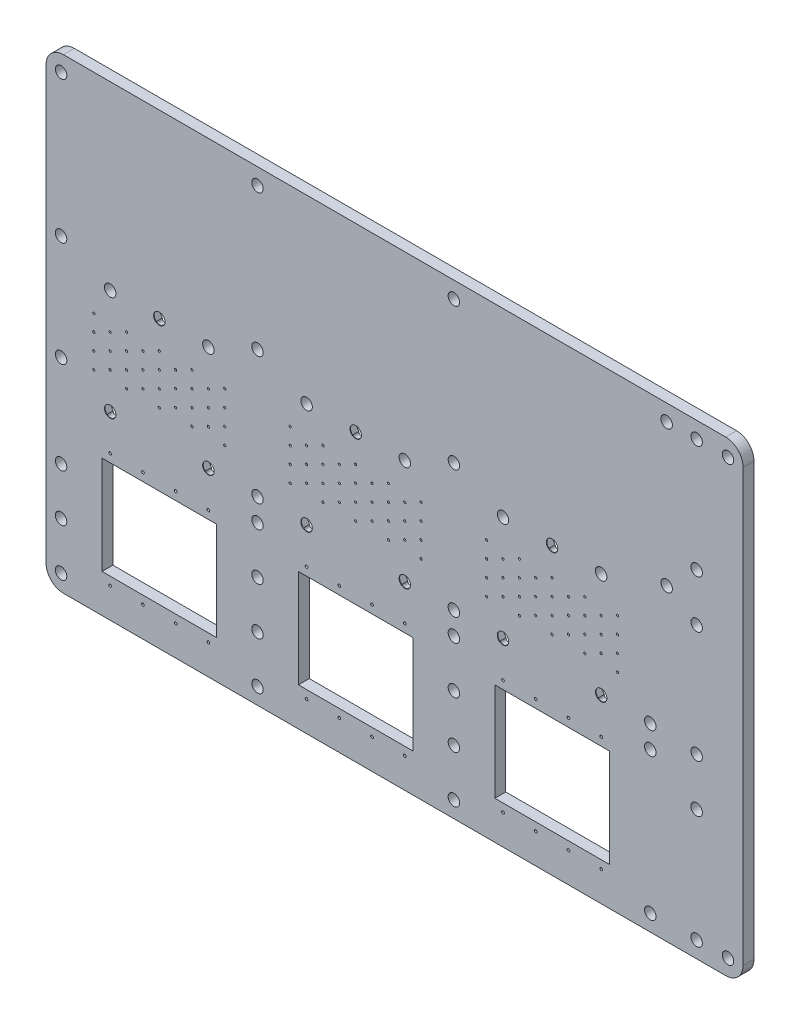
from build123d import *

# Parameters (mm, degrees)
BASE_PLATE_DEPTH          = 2
SENSOR_BLOCK_2_R          = 1.05
SENSOR_BLOCK_DEPTH        = 10
SCREW_HOLES_R             = 0.25
SCREW_HOLES_R_2           = 1.05
SCREW_HOLES_W             = 21
SCREW_HOLES_H             = 18
OBSERVATION_WINDOW_DEPTH  = 10
ROUTING_BLOCK_R           = 0.2
ROUTING_BLOCK_PORTS_DEPTH = 10
SKETCH5_R                 = 1.375
BOTTOM_O_RINGS_DEPTH      = 0.85
SKETCH6_R                 = 1
BOLT_RECESS_DEPTH         = 1.9


with BuildPart() as part:
    # Sketch1 → Base Plate (new body)
    with BuildSketch(Plane.XY):
        with BuildLine():
            Line((-64.286844883, 40.243593117), (-64.286844883, -38.896406883))
            ThreePointArc((-64.286844883, -38.896406883), (-63.355444448, -41.145006447), (-61.106844883, -42.076406883))
            Line((-61.106844883, -42.076406883), (60.283155117, -42.076406883))
            ThreePointArc((60.283155117, -42.076406883), (62.531754681, -41.145006447), (63.463155117, -38.896406883))
            Line((63.463155117, -38.896406883), (63.463155117, 40.243593117))
            ThreePointArc((63.463155117, 40.243593117), (62.531754681, 42.492192682), (60.283155117, 43.423593117))
            Line((60.283155117, 43.423593117), (-61.106844883, 43.423593117))
            ThreePointArc((-61.106844883, 43.423593117), (-63.355444448, 42.492192682), (-64.286844883, 40.243593117))
        make_face()
    extrude(amount=BASE_PLATE_DEPTH)

    # Sensor Block 2 → Sensor block (cut)
    with BuildSketch(Plane.XY.offset(2)):
        with Locations((54.962733273, 40.421899296)):
            Circle(SENSOR_BLOCK_2_R)
        with Locations((54.962733273, 19.684374225)):
            Circle(SENSOR_BLOCK_2_R)
        with Locations((54.962733273, 10.919873013)):
            Circle(SENSOR_BLOCK_2_R)
        with Locations((54.962733273, -9.580126987)):
            Circle(SENSOR_BLOCK_2_R)
        with Locations((54.962733273, -18.336863239)):
            Circle(SENSOR_BLOCK_2_R)
        with Locations((54.962733273, -39.076863239)):
            Circle(SENSOR_BLOCK_2_R)
    extrude(amount=-SENSOR_BLOCK_DEPTH, mode=Mode.SUBTRACT)

    # Screw Holes → Observation window (cut)
    with BuildSketch(Plane.XY.offset(2)):
        with Locations((-52.534890203, -15.579817184)):
            Circle(SCREW_HOLES_R)
        with Locations((-46.534890203, -15.579817184)):
            Circle(SCREW_HOLES_R)
        with Locations((-40.534890203, -15.579817184)):
            Circle(SCREW_HOLES_R)
        with Locations((-34.534890203, -15.579817184)):
            Circle(SCREW_HOLES_R)
        with Locations((-46.534890203, -36.579817184)):
            Circle(SCREW_HOLES_R)
        with Locations((-40.534890203, -36.579817184)):
            Circle(SCREW_HOLES_R)
        with Locations((-34.534890203, -36.579817184)):
            Circle(SCREW_HOLES_R)
        with Locations((-52.534890203, -36.579817184)):
            Circle(SCREW_HOLES_R)
        with Locations((-16.534890203, -15.579817184)):
            Circle(SCREW_HOLES_R)
        with Locations((-10.534890203, -15.579817184)):
            Circle(SCREW_HOLES_R)
        with Locations((-4.534890203, -15.579817184)):
            Circle(SCREW_HOLES_R)
        with Locations((1.465109797, -15.579817184)):
            Circle(SCREW_HOLES_R)
        with Locations((-10.534890203, -36.579817184)):
            Circle(SCREW_HOLES_R)
        with Locations((-4.534890203, -36.579817184)):
            Circle(SCREW_HOLES_R)
        with Locations((1.465109797, -36.579817184)):
            Circle(SCREW_HOLES_R)
        with Locations((-16.534890203, -36.579817184)):
            Circle(SCREW_HOLES_R)
        with Locations((19.465109797, -15.579817184)):
            Circle(SCREW_HOLES_R)
        with Locations((25.465109797, -15.579817184)):
            Circle(SCREW_HOLES_R)
        with Locations((31.465109797, -15.579817184)):
            Circle(SCREW_HOLES_R)
        with Locations((37.465109797, -15.579817184)):
            Circle(SCREW_HOLES_R)
        with Locations((25.465109797, -36.579817184)):
            Circle(SCREW_HOLES_R)
        with Locations((31.465109797, -36.579817184)):
            Circle(SCREW_HOLES_R)
        with Locations((37.465109797, -36.579817184)):
            Circle(SCREW_HOLES_R)
        with Locations((19.465109797, -36.579817184)):
            Circle(SCREW_HOLES_R)
        with Locations((-61.534890203, -21.746817184)):
            Circle(SCREW_HOLES_R_2)
        with Locations((-61.534890203, -30.413817184)):
            Circle(SCREW_HOLES_R_2)
        with Locations((-25.534890203, -13.079817184)):
            Circle(SCREW_HOLES_R_2)
        with Locations((-25.534890203, -21.746817184)):
            Circle(SCREW_HOLES_R_2)
        with Locations((-25.534890203, -30.413817184)):
            Circle(SCREW_HOLES_R_2)
        with Locations((-25.534890203, -39.080817184)):
            Circle(SCREW_HOLES_R_2)
        with Locations((10.465109797, -13.079817184)):
            Circle(SCREW_HOLES_R_2)
        with Locations((10.465109797, -21.746817184)):
            Circle(SCREW_HOLES_R_2)
        with Locations((10.465109797, -30.413817184)):
            Circle(SCREW_HOLES_R_2)
        with Locations((10.465109797, -39.080817184)):
            Circle(SCREW_HOLES_R_2)
        with Locations((46.465109797, -13.079817184)):
            Circle(SCREW_HOLES_R_2)
        with Locations((46.465109797, -39.080817184)):
            Circle(SCREW_HOLES_R_2)
        with Locations((-25.534890203, 40.420182816)):
            Circle(SCREW_HOLES_R_2)
        with Locations((-25.534890203, 14.419182816)):
            Circle(SCREW_HOLES_R_2)
        with Locations((10.465109797, 40.420182816)):
            Circle(SCREW_HOLES_R_2)
        with Locations((10.465109797, 14.419182816)):
            Circle(SCREW_HOLES_R_2)
        with Locations((-61.534890203, -4.836817184)):
            Circle(SCREW_HOLES_R_2)
        with Locations((-61.534890203, 40.420182816)):
            Circle(SCREW_HOLES_R_2)
        with Locations((-61.534890203, 14.419182816)):
            Circle(SCREW_HOLES_R_2)
        with Locations((-61.534890203, -39.080817184)):
            Circle(SCREW_HOLES_R_2)
        with Locations((49.465109797, 40.420182816)):
            Circle(SCREW_HOLES_R_2)
        with Locations((49.465109797, 14.419182816)):
            Circle(SCREW_HOLES_R_2)
        with Locations((60.711200436, -39.080817184)):
            Circle(SCREW_HOLES_R_2)
        with Locations((60.711200436, 40.420182816)):
            Circle(SCREW_HOLES_R_2)
        with Locations((-52.535925815, -8.955126987)):
            Circle(SCREW_HOLES_R_2)
        with Locations((-43.535925815, 10.294873013)):
            Circle(SCREW_HOLES_R_2)
        with Locations((-7.535925815, 10.294873013)):
            Circle(SCREW_HOLES_R_2)
        with Locations((-16.535925815, -8.955126987)):
            Circle(SCREW_HOLES_R_2)
        with Locations((28.464074185, 10.294873013)):
            Circle(SCREW_HOLES_R_2)
        with Locations((19.464074185, -8.955126987)):
            Circle(SCREW_HOLES_R_2)
        with Locations((-34.535925815, -8.955126987)):
            Circle(SCREW_HOLES_R_2)
        with Locations((1.464074185, -8.955126987)):
            Circle(SCREW_HOLES_R_2)
        with Locations((37.464074185, -8.955126987)):
            Circle(SCREW_HOLES_R_2)
        with Locations((-34.535925815, 10.284873013)):
            Circle(SCREW_HOLES_R_2)
        with Locations((1.464074185, 10.284873013)):
            Circle(SCREW_HOLES_R_2)
        with Locations((37.464074185, 10.284873013)):
            Circle(SCREW_HOLES_R_2)
        with Locations((-25.535925815, -8.955126987)):
            Circle(SCREW_HOLES_R_2)
        with Locations((10.464074185, -8.955126987)):
            Circle(SCREW_HOLES_R_2)
        with Locations((46.464074185, -8.955126987)):
            Circle(SCREW_HOLES_R_2)
        with Locations((-52.535925815, 10.284873013)):
            Circle(SCREW_HOLES_R_2)
        with Locations((-16.535925815, 10.284873013)):
            Circle(SCREW_HOLES_R_2)
        with Locations((19.464074185, 10.284873013)):
            Circle(SCREW_HOLES_R_2)
        with Locations((-43.534890203, -26.076406883)):
            Rectangle(SCREW_HOLES_W, SCREW_HOLES_H)
        with Locations((-7.534890203, -26.076406883)):
            Rectangle(SCREW_HOLES_W, SCREW_HOLES_H)
        with Locations((28.465109797, -26.076406883)):
            Rectangle(SCREW_HOLES_W, SCREW_HOLES_H)
    extrude(amount=-OBSERVATION_WINDOW_DEPTH, mode=Mode.SUBTRACT)

    # Routing Block → Routing Block Ports (cut)
    with BuildSketch(Plane.XY.offset(2)):
        with Locations((-55.535925815, 5.169873013)):
            Circle(ROUTING_BLOCK_R)
        with Locations((-55.535925815, 2.169873013)):
            Circle(ROUTING_BLOCK_R)
        with Locations((-52.535925815, 3.669873013)):
            Circle(ROUTING_BLOCK_R)
        with Locations((-49.535925815, 5.169873013)):
            Circle(ROUTING_BLOCK_R)
        with Locations((-49.535925815, 2.169873013)):
            Circle(ROUTING_BLOCK_R)
        with Locations((-46.535925815, 3.669873013)):
            Circle(ROUTING_BLOCK_R)
        with Locations((-46.535925815, 0.669873013)):
            Circle(ROUTING_BLOCK_R)
        with Locations((-46.535925815, -2.330126987)):
            Circle(ROUTING_BLOCK_R)
        with Locations((-49.535925815, -3.830126987)):
            Circle(ROUTING_BLOCK_R)
        with Locations((-49.535925815, -0.830126987)):
            Circle(ROUTING_BLOCK_R)
        with Locations((-43.535925815, -0.830126987)):
            Circle(ROUTING_BLOCK_R)
        with Locations((-43.535925815, -3.830126987)):
            Circle(ROUTING_BLOCK_R)
        with Locations((-52.535925815, -2.330126987)):
            Circle(ROUTING_BLOCK_R)
        with Locations((-55.535925815, -0.830126987)):
            Circle(ROUTING_BLOCK_R)
        with Locations((-55.535925815, -3.830126987)):
            Circle(ROUTING_BLOCK_R)
        with Locations((-43.535925815, 2.169873013)):
            Circle(ROUTING_BLOCK_R)
        with Locations((-40.535925815, 3.669873013)):
            Circle(ROUTING_BLOCK_R)
        with Locations((-40.535925815, 0.669873013)):
            Circle(ROUTING_BLOCK_R)
        with Locations((-40.535925815, -2.330126987)):
            Circle(ROUTING_BLOCK_R)
        with Locations((-37.535925815, -0.830126987)):
            Circle(ROUTING_BLOCK_R)
        with Locations((-37.535925815, -3.830126987)):
            Circle(ROUTING_BLOCK_R)
        with Locations((-37.535925815, 5.169873013)):
            Circle(ROUTING_BLOCK_R)
        with Locations((-37.535925815, 2.169873013)):
            Circle(ROUTING_BLOCK_R)
        with Locations((-34.535925815, 3.669873013)):
            Circle(ROUTING_BLOCK_R)
        with Locations((-34.535925815, 0.669873013)):
            Circle(ROUTING_BLOCK_R)
        with Locations((-31.535925815, 5.169873013)):
            Circle(ROUTING_BLOCK_R)
        with Locations((-31.535925815, 2.169873013)):
            Circle(ROUTING_BLOCK_R)
        with Locations((-31.535925815, -0.830126987)):
            Circle(ROUTING_BLOCK_R)
        with Locations((-34.535925815, -2.330126987)):
            Circle(ROUTING_BLOCK_R)
        with Locations((-31.535925815, -3.830126987)):
            Circle(ROUTING_BLOCK_R)
        with Locations((-19.535925815, 5.169873013)):
            Circle(ROUTING_BLOCK_R)
        with Locations((-16.535925815, 3.669873013)):
            Circle(ROUTING_BLOCK_R)
        with Locations((-19.535925815, 2.169873013)):
            Circle(ROUTING_BLOCK_R)
        with Locations((-19.535925815, -0.830126987)):
            Circle(ROUTING_BLOCK_R)
        with Locations((-16.535925815, 0.669873013)):
            Circle(ROUTING_BLOCK_R)
        with Locations((-19.535925815, -3.830126987)):
            Circle(ROUTING_BLOCK_R)
        with Locations((-16.535925815, -2.330126987)):
            Circle(ROUTING_BLOCK_R)
        with Locations((-13.535925815, -3.830126987)):
            Circle(ROUTING_BLOCK_R)
        with Locations((-13.535925815, -0.830126987)):
            Circle(ROUTING_BLOCK_R)
        with Locations((-13.535925815, 2.169873013)):
            Circle(ROUTING_BLOCK_R)
        with Locations((-13.535925815, 5.169873013)):
            Circle(ROUTING_BLOCK_R)
        with Locations((-10.535925815, 3.669873013)):
            Circle(ROUTING_BLOCK_R)
        with Locations((-10.535925815, 0.669873013)):
            Circle(ROUTING_BLOCK_R)
        with Locations((-10.535925815, -2.330126987)):
            Circle(ROUTING_BLOCK_R)
        with Locations((-7.535925815, -0.830126987)):
            Circle(ROUTING_BLOCK_R)
        with Locations((-7.535925815, 2.169873013)):
            Circle(ROUTING_BLOCK_R)
        with Locations((-4.535925815, -2.330126987)):
            Circle(ROUTING_BLOCK_R)
        with Locations((-4.535925815, 0.669873013)):
            Circle(ROUTING_BLOCK_R)
        with Locations((-1.535925815, -3.830126987)):
            Circle(ROUTING_BLOCK_R)
        with Locations((-7.535925815, -3.830126987)):
            Circle(ROUTING_BLOCK_R)
        with Locations((-1.535925815, -0.830126987)):
            Circle(ROUTING_BLOCK_R)
        with Locations((1.464074185, -2.330126987)):
            Circle(ROUTING_BLOCK_R)
        with Locations((1.464074185, 3.669873013)):
            Circle(ROUTING_BLOCK_R)
        with Locations((-1.535925815, 2.169873013)):
            Circle(ROUTING_BLOCK_R)
        with Locations((-7.535925815, 5.169873013)):
            Circle(ROUTING_BLOCK_R)
        with Locations((-4.535925815, 3.669873013)):
            Circle(ROUTING_BLOCK_R)
        with Locations((-1.535925815, 5.169873013)):
            Circle(ROUTING_BLOCK_R)
        with Locations((4.464074185, 5.169873013)):
            Circle(ROUTING_BLOCK_R)
        with Locations((4.464074185, 2.169873013)):
            Circle(ROUTING_BLOCK_R)
        with Locations((4.464074185, -0.830126987)):
            Circle(ROUTING_BLOCK_R)
        with Locations((4.464074185, -3.830126987)):
            Circle(ROUTING_BLOCK_R)
        with Locations((16.464074185, 5.169873013)):
            Circle(ROUTING_BLOCK_R)
        with Locations((19.464074185, 3.669873013)):
            Circle(ROUTING_BLOCK_R)
        with Locations((22.464074185, 5.169873013)):
            Circle(ROUTING_BLOCK_R)
        with Locations((16.464074185, 2.169873013)):
            Circle(ROUTING_BLOCK_R)
        with Locations((16.464074185, -0.830126987)):
            Circle(ROUTING_BLOCK_R)
        with Locations((19.464074185, 0.669873013)):
            Circle(ROUTING_BLOCK_R)
        with Locations((16.464074185, -3.830126987)):
            Circle(ROUTING_BLOCK_R)
        with Locations((19.464074185, -2.330126987)):
            Circle(ROUTING_BLOCK_R)
        with Locations((22.464074185, -0.830126987)):
            Circle(ROUTING_BLOCK_R)
        with Locations((22.464074185, -3.830126987)):
            Circle(ROUTING_BLOCK_R)
        with Locations((25.464074185, -2.330126987)):
            Circle(ROUTING_BLOCK_R)
        with Locations((22.464074185, 2.169873013)):
            Circle(ROUTING_BLOCK_R)
        with Locations((25.464074185, 3.669873013)):
            Circle(ROUTING_BLOCK_R)
        with Locations((25.464074185, 0.669873013)):
            Circle(ROUTING_BLOCK_R)
        with Locations((28.464074185, 5.169873013)):
            Circle(ROUTING_BLOCK_R)
        with Locations((28.464074185, 2.169873013)):
            Circle(ROUTING_BLOCK_R)
        with Locations((28.464074185, -3.830126987)):
            Circle(ROUTING_BLOCK_R)
        with Locations((28.464074185, -0.830126987)):
            Circle(ROUTING_BLOCK_R)
        with Locations((31.464074185, -2.330126987)):
            Circle(ROUTING_BLOCK_R)
        with Locations((31.464074185, 3.669873013)):
            Circle(ROUTING_BLOCK_R)
        with Locations((31.464074185, 0.669873013)):
            Circle(ROUTING_BLOCK_R)
        with Locations((34.464074185, 2.169873013)):
            Circle(ROUTING_BLOCK_R)
        with Locations((34.464074185, -0.830126987)):
            Circle(ROUTING_BLOCK_R)
        with Locations((34.464074185, 5.169873013)):
            Circle(ROUTING_BLOCK_R)
        with Locations((37.464074185, 3.669873013)):
            Circle(ROUTING_BLOCK_R)
        with Locations((40.464074185, 5.169873013)):
            Circle(ROUTING_BLOCK_R)
        with Locations((37.464074185, 0.669873013)):
            Circle(ROUTING_BLOCK_R)
        with Locations((40.464074185, 2.169873013)):
            Circle(ROUTING_BLOCK_R)
        with Locations((40.464074185, -0.830126987)):
            Circle(ROUTING_BLOCK_R)
        with Locations((37.464074185, -2.330126987)):
            Circle(ROUTING_BLOCK_R)
        with Locations((34.464074185, -3.830126987)):
            Circle(ROUTING_BLOCK_R)
        with Locations((40.464074185, -3.830126987)):
            Circle(ROUTING_BLOCK_R)
        with Locations((-52.535925815, 0.669873013)):
            Circle(ROUTING_BLOCK_R)
        with Locations((-43.535925815, 5.169873013)):
            Circle(ROUTING_BLOCK_R)
        with Locations((1.464074185, 0.669873013)):
            Circle(ROUTING_BLOCK_R)
    extrude(amount=-ROUTING_BLOCK_PORTS_DEPTH, mode=Mode.SUBTRACT)

    # Sketch5 → Bottom O-rings (cut)
    with BuildSketch(Plane(origin=(0, 0, 0), x_dir=(-1, 0, 0), z_dir=(0, 0, -1))):
        with Locations((-40.464074185, 5.169873013)):
            Circle(SKETCH5_R)
        with Locations((-40.464074185, 2.169873013)):
            Circle(SKETCH5_R)
        with Locations((-37.464074185, 3.669873013)):
            Circle(SKETCH5_R)
        with Locations((-40.464074185, -0.830126987)):
            Circle(SKETCH5_R)
        with Locations((-40.464074185, -3.830126987)):
            Circle(SKETCH5_R)
        with Locations((-37.464074185, 0.669873013)):
            Circle(SKETCH5_R)
        with Locations((-37.464074185, -2.330126987)):
            Circle(SKETCH5_R)
        with Locations((-34.464074185, 5.169873013)):
            Circle(SKETCH5_R)
        with Locations((-34.464074185, 2.169873013)):
            Circle(SKETCH5_R)
        with Locations((-31.464074185, 3.669873013)):
            Circle(SKETCH5_R)
        with Locations((-34.464074185, -0.830126987)):
            Circle(SKETCH5_R)
        with Locations((-34.464074185, -3.830126987)):
            Circle(SKETCH5_R)
        with Locations((-31.464074185, 0.669873013)):
            Circle(SKETCH5_R)
        with Locations((-31.464074185, -2.330126987)):
            Circle(SKETCH5_R)
        with Locations((-28.464074185, 5.169873013)):
            Circle(SKETCH5_R)
        with Locations((-28.464074185, 2.169873013)):
            Circle(SKETCH5_R)
        with Locations((-25.464074185, 3.669873013)):
            Circle(SKETCH5_R)
        with Locations((-28.464074185, -0.830126987)):
            Circle(SKETCH5_R)
        with Locations((-28.464074185, -3.830126987)):
            Circle(SKETCH5_R)
        with Locations((-25.464074185, 0.669873013)):
            Circle(SKETCH5_R)
        with Locations((-25.464074185, -2.330126987)):
            Circle(SKETCH5_R)
        with Locations((-22.464074185, 5.169873013)):
            Circle(SKETCH5_R)
        with Locations((-22.464074185, 2.169873013)):
            Circle(SKETCH5_R)
        with Locations((-19.464074185, 3.669873013)):
            Circle(SKETCH5_R)
        with Locations((-22.464074185, -0.830126987)):
            Circle(SKETCH5_R)
        with Locations((-22.464074185, -3.830126987)):
            Circle(SKETCH5_R)
        with Locations((-19.464074185, 0.669873013)):
            Circle(SKETCH5_R)
        with Locations((-19.464074185, -2.330126987)):
            Circle(SKETCH5_R)
        with Locations((-16.464074185, 5.169873013)):
            Circle(SKETCH5_R)
        with Locations((-16.464074185, 2.169873013)):
            Circle(SKETCH5_R)
        with Locations((-16.464074185, -0.830126987)):
            Circle(SKETCH5_R)
        with Locations((-16.464074185, -3.830126987)):
            Circle(SKETCH5_R)
        with Locations((-4.464074185, 5.169873013)):
            Circle(SKETCH5_R)
        with Locations((-4.464074185, 2.169873013)):
            Circle(SKETCH5_R)
        with Locations((-1.464074185, 3.669873013)):
            Circle(SKETCH5_R)
        with Locations((-4.464074185, -0.830126987)):
            Circle(SKETCH5_R)
        with Locations((-4.464074185, -3.830126987)):
            Circle(SKETCH5_R)
        with Locations((-1.464074185, 0.669873013)):
            Circle(SKETCH5_R)
        with Locations((-1.464074185, -2.330126987)):
            Circle(SKETCH5_R)
        with Locations((1.535925815, 5.169873013)):
            Circle(SKETCH5_R)
        with Locations((1.535925815, 2.169873013)):
            Circle(SKETCH5_R)
        with Locations((4.535925815, 3.669873013)):
            Circle(SKETCH5_R)
        with Locations((1.535925815, -0.830126987)):
            Circle(SKETCH5_R)
        with Locations((1.535925815, -3.830126987)):
            Circle(SKETCH5_R)
        with Locations((4.535925815, 0.669873013)):
            Circle(SKETCH5_R)
        with Locations((4.535925815, -2.330126987)):
            Circle(SKETCH5_R)
        with Locations((7.535925815, 5.169873013)):
            Circle(SKETCH5_R)
        with Locations((7.535925815, 2.169873013)):
            Circle(SKETCH5_R)
        with Locations((10.535925815, 3.669873013)):
            Circle(SKETCH5_R)
        with Locations((7.535925815, -0.830126987)):
            Circle(SKETCH5_R)
        with Locations((7.535925815, -3.830126987)):
            Circle(SKETCH5_R)
        with Locations((10.535925815, 0.669873013)):
            Circle(SKETCH5_R)
        with Locations((10.535925815, -2.330126987)):
            Circle(SKETCH5_R)
        with Locations((13.535925815, 5.169873013)):
            Circle(SKETCH5_R)
        with Locations((13.535925815, 2.169873013)):
            Circle(SKETCH5_R)
        with Locations((16.535925815, 3.669873013)):
            Circle(SKETCH5_R)
        with Locations((13.535925815, -0.830126987)):
            Circle(SKETCH5_R)
        with Locations((13.535925815, -3.830126987)):
            Circle(SKETCH5_R)
        with Locations((16.535925815, 0.669873013)):
            Circle(SKETCH5_R)
        with Locations((16.535925815, -2.330126987)):
            Circle(SKETCH5_R)
        with Locations((19.535925815, 5.169873013)):
            Circle(SKETCH5_R)
        with Locations((19.535925815, 2.169873013)):
            Circle(SKETCH5_R)
        with Locations((19.535925815, -0.830126987)):
            Circle(SKETCH5_R)
        with Locations((19.535925815, -3.830126987)):
            Circle(SKETCH5_R)
        with Locations((31.535925815, 5.169873013)):
            Circle(SKETCH5_R)
        with Locations((31.535925815, 2.169873013)):
            Circle(SKETCH5_R)
        with Locations((34.535925815, 3.669873013)):
            Circle(SKETCH5_R)
        with Locations((31.535925815, -0.830126987)):
            Circle(SKETCH5_R)
        with Locations((31.535925815, -3.830126987)):
            Circle(SKETCH5_R)
        with Locations((34.535925815, 0.669873013)):
            Circle(SKETCH5_R)
        with Locations((34.535925815, -2.330126987)):
            Circle(SKETCH5_R)
        with Locations((37.535925815, 5.169873013)):
            Circle(SKETCH5_R)
        with Locations((37.535925815, 2.169873013)):
            Circle(SKETCH5_R)
        with Locations((40.535925815, 3.669873013)):
            Circle(SKETCH5_R)
        with Locations((37.535925815, -0.830126987)):
            Circle(SKETCH5_R)
        with Locations((37.535925815, -3.830126987)):
            Circle(SKETCH5_R)
        with Locations((40.535925815, 0.669873013)):
            Circle(SKETCH5_R)
        with Locations((40.535925815, -2.330126987)):
            Circle(SKETCH5_R)
        with Locations((43.535925815, 5.169873013)):
            Circle(SKETCH5_R)
        with Locations((43.535925815, 2.169873013)):
            Circle(SKETCH5_R)
        with Locations((46.535925815, 3.669873013)):
            Circle(SKETCH5_R)
        with Locations((43.535925815, -0.830126987)):
            Circle(SKETCH5_R)
        with Locations((43.535925815, -3.830126987)):
            Circle(SKETCH5_R)
        with Locations((46.535925815, 0.669873013)):
            Circle(SKETCH5_R)
        with Locations((46.535925815, -2.330126987)):
            Circle(SKETCH5_R)
        with Locations((49.535925815, 5.169873013)):
            Circle(SKETCH5_R)
        with Locations((49.535925815, 2.169873013)):
            Circle(SKETCH5_R)
        with Locations((52.535925815, 3.669873013)):
            Circle(SKETCH5_R)
        with Locations((49.535925815, -0.830126987)):
            Circle(SKETCH5_R)
        with Locations((49.535925815, -3.830126987)):
            Circle(SKETCH5_R)
        with Locations((52.535925815, 0.669873013)):
            Circle(SKETCH5_R)
        with Locations((52.535925815, -2.330126987)):
            Circle(SKETCH5_R)
        with Locations((55.535925815, 5.169873013)):
            Circle(SKETCH5_R)
        with Locations((55.535925815, 2.169873013)):
            Circle(SKETCH5_R)
        with Locations((55.535925815, -0.830126987)):
            Circle(SKETCH5_R)
        with Locations((55.535925815, -3.830126987)):
            Circle(SKETCH5_R)
        with Locations((-37.465109797, -15.579817184)):
            Circle(SKETCH5_R)
        with Locations((-31.465109797, -15.579817184)):
            Circle(SKETCH5_R)
        with Locations((-25.465109797, -15.579817184)):
            Circle(SKETCH5_R)
        with Locations((-19.465109797, -15.579817184)):
            Circle(SKETCH5_R)
        with Locations((-31.465109797, -36.579817184)):
            Circle(SKETCH5_R)
        with Locations((-25.465109797, -36.579817184)):
            Circle(SKETCH5_R)
        with Locations((-19.465109797, -36.579817184)):
            Circle(SKETCH5_R)
        with Locations((-37.465109797, -36.579817184)):
            Circle(SKETCH5_R)
        with Locations((-1.465109797, -15.579817184)):
            Circle(SKETCH5_R)
        with Locations((4.534890203, -15.579817184)):
            Circle(SKETCH5_R)
        with Locations((10.534890203, -15.579817184)):
            Circle(SKETCH5_R)
        with Locations((16.534890203, -15.579817184)):
            Circle(SKETCH5_R)
        with Locations((4.534890203, -36.579817184)):
            Circle(SKETCH5_R)
        with Locations((10.534890203, -36.579817184)):
            Circle(SKETCH5_R)
        with Locations((16.534890203, -36.579817184)):
            Circle(SKETCH5_R)
        with Locations((-1.465109797, -36.579817184)):
            Circle(SKETCH5_R)
        with Locations((34.534890203, -15.579817184)):
            Circle(SKETCH5_R)
        with Locations((40.534890203, -15.579817184)):
            Circle(SKETCH5_R)
        with Locations((46.534890203, -15.579817184)):
            Circle(SKETCH5_R)
        with Locations((52.534890203, -15.579817184)):
            Circle(SKETCH5_R)
        with Locations((40.534890203, -36.579817184)):
            Circle(SKETCH5_R)
        with Locations((46.534890203, -36.579817184)):
            Circle(SKETCH5_R)
        with Locations((52.534890203, -36.579817184)):
            Circle(SKETCH5_R)
        with Locations((34.534890203, -36.579817184)):
            Circle(SKETCH5_R)
    extrude(amount=-BOTTOM_O_RINGS_DEPTH, mode=Mode.SUBTRACT)

    # Sketch6 → Bolt Recess (cut)
    # profile 1 of 9: a face of its own
    with BuildSketch(Plane(origin=(0, 0, 0), x_dir=(-1, 0, 0), z_dir=(0, 0, -1))):
        with BuildLine():
            Line((-38.144263528, -11.006121092), (-36.779203786, -11.003419556))
            ThreePointArc((-36.779203786, -11.003419556), (-36.278127138, -11.005280382), (-36.027058572, -10.571637851))
            Line((-36.027058572, -10.571637851), (-35.34589496, -9.388227981))
            ThreePointArc((-35.34589496, -9.388227981), (-35.09589679, -8.956568532), (-35.343554727, -8.523562168))
            Line((-35.343554727, -8.523562168), (-36.028331685, -7.337493685))
            ThreePointArc((-36.028331685, -7.337493685), (-36.277403089, -6.905006687), (-36.776481245, -6.903406139))
            Line((-36.776481245, -6.903406139), (-38.145051131, -6.906114622))
            ThreePointArc((-38.145051131, -6.906114622), (-38.645829539, -6.904766448), (-38.896605462, -7.338231866))
            Line((-38.896605462, -7.338231866), (-39.574563959, -8.516073375))
            ThreePointArc((-39.574563959, -8.516073375), (-39.832248699, -8.951264555), (-39.578352683, -9.388676949))
            Line((-39.578352683, -9.388676949), (-38.893676811, -10.574570347))
            ThreePointArc((-38.893676811, -10.574570347), (-38.643192824, -11.006065674), (-38.144263528, -11.006121092))
        make_face()
        with Locations((-37.464074185, -8.955126987)):
            Circle(SKETCH6_R, mode=Mode.SUBTRACT)
    # profile 2 of 9: a face of its own
    with BuildSketch(Plane(origin=(0, 0, 0), x_dir=(-1, 0, 0), z_dir=(0, 0, -1))):
        with BuildLine():
            Line((-20.142552217, -11.006687087), (-18.777492475, -11.00398555))
            ThreePointArc((-18.777492475, -11.00398555), (-18.276415827, -11.005846377), (-18.025347261, -10.572203845))
            Line((-18.025347261, -10.572203845), (-17.344183649, -9.388793975))
            ThreePointArc((-17.344183649, -9.388793975), (-17.094185479, -8.957134526), (-17.341843417, -8.524128162))
            Line((-17.341843417, -8.524128162), (-18.026620374, -7.338059679))
            ThreePointArc((-18.026620374, -7.338059679), (-18.275691778, -6.905572681), (-18.774769934, -6.903972133))
            Line((-18.774769934, -6.903972133), (-20.14333982, -6.906680616))
            ThreePointArc((-20.14333982, -6.906680616), (-20.644118228, -6.905332443), (-20.894894151, -7.338797861))
            Line((-20.894894151, -7.338797861), (-21.572852648, -8.516639369))
            ThreePointArc((-21.572852648, -8.516639369), (-21.830537388, -8.95183055), (-21.576641372, -9.389242943))
            Line((-21.576641372, -9.389242943), (-20.8919655, -10.575136341))
            ThreePointArc((-20.8919655, -10.575136341), (-20.641481513, -11.006631668), (-20.142552217, -11.006687087))
        make_face()
        with Locations((-19.462362874, -8.955692981)):
            Circle(SKETCH6_R, mode=Mode.SUBTRACT)
    # profile 3 of 9: a face of its own
    with BuildSketch(Plane(origin=(0, 0, 0), x_dir=(-1, 0, 0), z_dir=(0, 0, -1))):
        with BuildLine():
            Line((-2.145148695, -11.006775378), (-0.780088952, -11.004073842))
            ThreePointArc((-0.780088952, -11.004073842), (-0.279012304, -11.005934668), (-0.027943739, -10.572292136))
            Line((-0.027943739, -10.572292136), (0.653219874, -9.388882267))
            ThreePointArc((0.653219874, -9.388882267), (0.903218043, -8.957222818), (0.655560106, -8.524216454))
            Line((0.655560106, -8.524216454), (-0.029216852, -7.338147971))
            ThreePointArc((-0.029216852, -7.338147971), (-0.278288255, -6.905660972), (-0.777366412, -6.904060424))
            Line((-0.777366412, -6.904060424), (-2.145936298, -6.906768908))
            ThreePointArc((-2.145936298, -6.906768908), (-2.646714706, -6.905420734), (-2.897490628, -7.338886152))
            Line((-2.897490628, -7.338886152), (-3.575449126, -8.516727661))
            ThreePointArc((-3.575449126, -8.516727661), (-3.833133865, -8.951918841), (-3.57923785, -9.389331234))
            Line((-3.57923785, -9.389331234), (-2.894561977, -10.575224633))
            ThreePointArc((-2.894561977, -10.575224633), (-2.64407799, -11.00671996), (-2.145148695, -11.006775378))
        make_face()
        with Locations((-1.464959352, -8.955781273)):
            Circle(SKETCH6_R, mode=Mode.SUBTRACT)
    # profile 4 of 9: a face of its own
    with BuildSketch(Plane(origin=(0, 0, 0), x_dir=(-1, 0, 0), z_dir=(0, 0, -1))):
        with BuildLine():
            Line((15.860655248, -11.012370167), (17.22571499, -11.00966863))
            ThreePointArc((17.22571499, -11.00966863), (17.726791639, -11.011529457), (17.977860204, -10.577886925))
            Line((17.977860204, -10.577886925), (18.659023816, -9.394477055))
            ThreePointArc((18.659023816, -9.394477055), (18.909021986, -8.962817606), (18.661364049, -8.529811242))
            Line((18.661364049, -8.529811242), (17.976587091, -7.343742759))
            ThreePointArc((17.976587091, -7.343742759), (17.727515687, -6.911255761), (17.228437531, -6.909655213))
            Line((17.228437531, -6.909655213), (15.859867645, -6.912363696))
            ThreePointArc((15.859867645, -6.912363696), (15.359089237, -6.911015522), (15.108313314, -7.34448094))
            Line((15.108313314, -7.34448094), (14.430354817, -8.522322449))
            ThreePointArc((14.430354817, -8.522322449), (14.172670077, -8.957513629), (14.426566093, -9.394926023))
            Line((14.426566093, -9.394926023), (15.111241965, -10.580819421))
            ThreePointArc((15.111241965, -10.580819421), (15.361725952, -11.012314748), (15.860655248, -11.012370167))
        make_face()
        with Locations((16.540844591, -8.961376061)):
            Circle(SKETCH6_R, mode=Mode.SUBTRACT)
    # profile 5 of 9: a face of its own
    with BuildSketch(Plane(origin=(0, 0, 0), x_dir=(-1, 0, 0), z_dir=(0, 0, -1))):
        with BuildLine():
            Line((33.856549019, -11.003119178), (35.221608761, -11.000417641))
            ThreePointArc((35.221608761, -11.000417641), (35.72268541, -11.002278468), (35.973753975, -10.568635936))
            Line((35.973753975, -10.568635936), (36.654917587, -9.385226066))
            ThreePointArc((36.654917587, -9.385226066), (36.904915757, -8.953566617), (36.65725782, -8.520560253))
            Line((36.65725782, -8.520560253), (35.972480862, -7.33449177))
            ThreePointArc((35.972480862, -7.33449177), (35.723409458, -6.902004772), (35.224331302, -6.900404224))
            Line((35.224331302, -6.900404224), (33.855761416, -6.903112707))
            ThreePointArc((33.855761416, -6.903112707), (33.354983008, -6.901764533), (33.104207085, -7.335229951))
            Line((33.104207085, -7.335229951), (32.426248588, -8.51307146))
            ThreePointArc((32.426248588, -8.51307146), (32.168563849, -8.94826264), (32.422459864, -9.385675034))
            Line((32.422459864, -9.385675034), (33.107135736, -10.571568432))
            ThreePointArc((33.107135736, -10.571568432), (33.357619723, -11.003063759), (33.856549019, -11.003119178))
        make_face()
        with Locations((34.536738362, -8.952125072)):
            Circle(SKETCH6_R, mode=Mode.SUBTRACT)
    # profile 6 of 9: a face of its own
    with BuildSketch(Plane(origin=(0, 0, 0), x_dir=(-1, 0, 0), z_dir=(0, 0, -1))):
        with BuildLine():
            Line((51.868582731, -10.994760686), (53.233642473, -10.99205915))
            ThreePointArc((53.233642473, -10.99205915), (53.734719121, -10.993919976), (53.985787687, -10.560277444))
            Line((53.985787687, -10.560277444), (54.666951299, -9.376867575))
            ThreePointArc((54.666951299, -9.376867575), (54.916949469, -8.945208125), (54.669291531, -8.512201762))
            Line((54.669291531, -8.512201762), (53.984514574, -7.326133279))
            ThreePointArc((53.984514574, -7.326133279), (53.73544317, -6.89364628), (53.236365014, -6.892045732))
            Line((53.236365014, -6.892045732), (51.867795128, -6.894754216))
            ThreePointArc((51.867795128, -6.894754216), (51.36701672, -6.893406042), (51.116240797, -7.32687146))
            Line((51.116240797, -7.32687146), (50.4382823, -8.504712969))
            ThreePointArc((50.4382823, -8.504712969), (50.18059756, -8.939904149), (50.434493576, -9.377316542))
            Line((50.434493576, -9.377316542), (51.119169448, -10.56320994))
            ThreePointArc((51.119169448, -10.56320994), (51.369653435, -10.994705268), (51.868582731, -10.994760686))
        make_face()
        with Locations((52.548772074, -8.943766581)):
            Circle(SKETCH6_R, mode=Mode.SUBTRACT)
    # profile 7 of 9: a face of its own
    with BuildSketch(Plane(origin=(0, 0, 0), x_dir=(-1, 0, 0), z_dir=(0, 0, -1))):
        with BuildLine():
            Line((-29.145844458, 8.244152454), (-27.780784716, 8.246853991))
            ThreePointArc((-27.780784716, 8.246853991), (-27.279708068, 8.244993164), (-27.028639502, 8.678635696))
            Line((-27.028639502, 8.678635696), (-26.34747589, 9.862045565))
            ThreePointArc((-26.34747589, 9.862045565), (-26.09747772, 10.293705015), (-26.345135658, 10.726711378))
            Line((-26.345135658, 10.726711378), (-27.029912616, 11.912779861))
            ThreePointArc((-27.029912616, 11.912779861), (-27.278984019, 12.34526686), (-27.778062175, 12.346867408))
            Line((-27.778062175, 12.346867408), (-29.146632061, 12.344158924))
            ThreePointArc((-29.146632061, 12.344158924), (-29.64741047, 12.345507098), (-29.898186392, 11.91204168))
            Line((-29.898186392, 11.91204168), (-30.576144889, 10.734200171))
            ThreePointArc((-30.576144889, 10.734200171), (-30.833829629, 10.299008991), (-30.579933614, 9.861596598))
            Line((-30.579933614, 9.861596598), (-29.895257741, 8.6757032))
            ThreePointArc((-29.895257741, 8.6757032), (-29.644773754, 8.244207872), (-29.145844458, 8.244152454))
        make_face()
        with Locations((-28.465655115, 10.295146559)):
            Circle(SKETCH6_R, mode=Mode.SUBTRACT)
    # profile 8 of 9: a face of its own
    with BuildSketch(Plane(origin=(0, 0, 0), x_dir=(-1, 0, 0), z_dir=(0, 0, -1))):
        with BuildLine():
            Line((6.857640103, 8.251072649), (8.222699845, 8.253774185))
            ThreePointArc((8.222699845, 8.253774185), (8.723776493, 8.251913359), (8.974845059, 8.685555891))
            Line((8.974845059, 8.685555891), (9.656008671, 9.86896576))
            ThreePointArc((9.656008671, 9.86896576), (9.906006841, 10.30062521), (9.658348903, 10.733631573))
            Line((9.658348903, 10.733631573), (8.973571945, 11.919700056))
            ThreePointArc((8.973571945, 11.919700056), (8.724500542, 12.352187055), (8.225422386, 12.353787603))
            Line((8.225422386, 12.353787603), (6.8568525, 12.351079119))
            ThreePointArc((6.8568525, 12.351079119), (6.356074091, 12.352427293), (6.105298169, 11.918961875))
            Line((6.105298169, 11.918961875), (5.427339672, 10.741120366))
            ThreePointArc((5.427339672, 10.741120366), (5.169654932, 10.305929186), (5.423550947, 9.868516793))
            Line((5.423550947, 9.868516793), (6.10822682, 8.682623395))
            ThreePointArc((6.10822682, 8.682623395), (6.358710807, 8.251128067), (6.857640103, 8.251072649))
        make_face()
        with Locations((7.537829446, 10.302066754)):
            Circle(SKETCH6_R, mode=Mode.SUBTRACT)
    # profile 9 of 9: a face of its own
    with BuildSketch(Plane(origin=(0, 0, 0), x_dir=(-1, 0, 0), z_dir=(0, 0, -1))):
        with BuildLine():
            Line((42.85885873, 8.242553233), (44.223918472, 8.245254769))
            ThreePointArc((44.223918472, 8.245254769), (44.72499512, 8.243393943), (44.976063686, 8.677036474))
            Line((44.976063686, 8.677036474), (45.657227298, 9.860446344))
            ThreePointArc((45.657227298, 9.860446344), (45.907225468, 10.292105793), (45.65956753, 10.725112157))
            Line((45.65956753, 10.725112157), (44.974790572, 11.91118064))
            ThreePointArc((44.974790572, 11.91118064), (44.725719169, 12.343667638), (44.226641013, 12.345268186))
            Line((44.226641013, 12.345268186), (42.858071127, 12.342559703))
            ThreePointArc((42.858071127, 12.342559703), (42.357292719, 12.343907877), (42.106516796, 11.910442459))
            Line((42.106516796, 11.910442459), (41.428558299, 10.73260095))
            ThreePointArc((41.428558299, 10.73260095), (41.170873559, 10.29740977), (41.424769574, 9.859997376))
            Line((41.424769574, 9.859997376), (42.109445447, 8.674103978))
            ThreePointArc((42.109445447, 8.674103978), (42.359929434, 8.242608651), (42.85885873, 8.242553233))
        make_face()
        with Locations((43.539048073, 10.293547338)):
            Circle(SKETCH6_R, mode=Mode.SUBTRACT)
    extrude(amount=-BOLT_RECESS_DEPTH, mode=Mode.SUBTRACT)


solid = part.part
